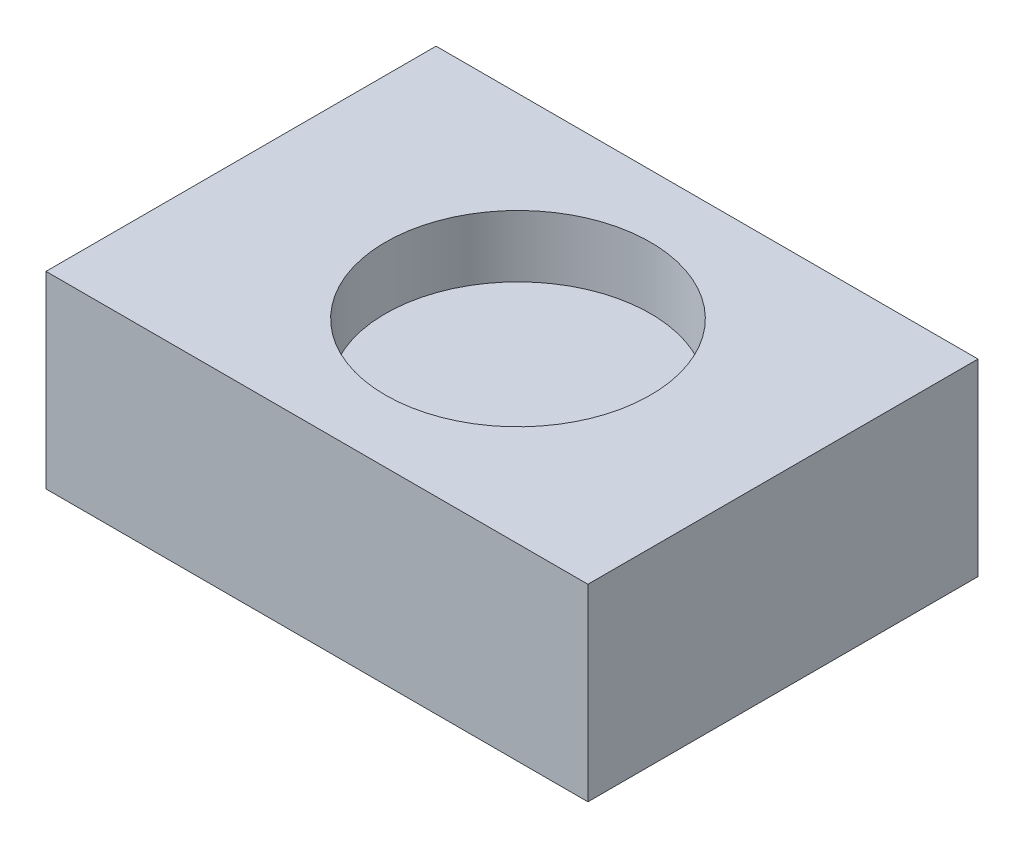
from build123d import *

# Parameters (mm, degrees)
CUT_EXTRUDE7_DEPTH               = 1010.950493836
CUT_EXTRUDE7_DEPTH_BACK          = 1010.950493836
SKETCH13_W                       = 48.176434887
SKETCH13_H                       = 155.804640487
SKETCH4_W                        = 600
SKETCH4_H                        = 44.158972604
CUT_EXTRUDE2_DEPTH               = 1010.950493836
SKETCH7_W                        = 159.807953253
SKETCH7_H                        = 69.49104999
BOSS_EXTRUDE7_DEPTH              = 5
FILLET5_R                        = 10
F_5_8_0_625_DIAMETER_HOLE1_D     = 15.875
F_5_8_0_625_DIAMETER_HOLE1_DEPTH = 30
F_5_8_0_625_DIAMETER_HOLE1_TIP   = 4.769331164
BOSS_EXTRUDE8_DEPTH              = 10
BOSS_EXTRUDE8_DEPTH_BACK         = 10
SKETCH16_W                       = 57.403477863
SKETCH16_H                       = 23.203595883
SKETCH17_W                       = 38.256761469
SKETCH17_H                       = 12.64819079
BOSS_EXTRUDE9_DEPTH              = 10
SKETCH18_W                       = 120
SKETCH18_H                       = 104.74536306
CUT_EXTRUDE8_DEPTH               = 161
FILLET6_R                        = 10
SKETCH19_R                       = 15
CUT_EXTRUDE9_DEPTH               = 7
CUT_EXTRUDE11_DEPTH              = 1010.950493856
CUT_EXTRUDE11_DEPTH_BACK         = 1010.950493856
SKETCH22_W                       = 1481.455902665
SKETCH22_H                       = 524.99926461
SKETCH22_W_2                     = 774.615564444
SKETCH22_H_2                     = 130
SKETCH23_W                       = 1033.221047575
SKETCH23_H                       = 313.410359552
SKETCH23_W_2                     = 790.959514037
SKETCH23_H_2                     = 163.499719248
CUT_EXTRUDE12_DEPTH              = 915.822387207
CUT_EXTRUDE13_DEPTH              = 908.868382599
CUT_EXTRUDE13_DEPTH_BACK         = 908.868382599
SKETCH24_W                       = 774.615564444
SKETCH24_H                       = 42.920513698
CUT_EXTRUDE14_DEPTH              = 908.868382607
CUT_EXTRUDE14_DEPTH_BACK         = 908.868382607
SKETCH25_W                       = 913.785959768
SKETCH25_H                       = 329.26502352
SKETCH25_W_2                     = 61.349903791
SKETCH25_H_2                     = 44.158972604


# Read off the part's stored shape, not the designer's step: Revolve1
with BuildPart() as part:
    # Revolve1 outline → Revolve1 (revolve)
    with BuildSketch(Plane.YX):
        with BuildLine():
            Line((0, 1000), (0, 0))
            ThreePointArc((0, 0), (70.710678154, 29.289321917), (100, 100.0000001))
            Line((100, 100.0000001), (100, 899.9999999))
            ThreePointArc((100, 899.9999999), (70.710678154, 970.710678083), (0, 1000))
        make_face()
    revolve(axis=Axis((0, 0, 0), (1, 0, 0)))

    # Sketch13 → Cut-Extrude7 (cut, two sides: drawn at the far end of the back side and taken through both)
    with BuildSketch(Plane(origin=(0, 0, 0), x_dir=(1, 0, 0), z_dir=(0, 1, 0)).offset(-CUT_EXTRUDE7_DEPTH_BACK)):
        with Locations((5.911782557, -3.075091589)):
            Rectangle(SKETCH13_W, SKETCH13_H)
    extrude(amount=CUT_EXTRUDE7_DEPTH + CUT_EXTRUDE7_DEPTH_BACK, mode=Mode.SUBTRACT)

    # Sketch4 → Cut-Extrude2 (cut, through all)
    with BuildSketch(Plane(origin=(0, 0, 0), x_dir=(1, 0, 0), z_dir=(0, 1, 0))):
        with Locations((595, 0)):
            Rectangle(SKETCH4_W, SKETCH4_H)
    extrude(amount=CUT_EXTRUDE2_DEPTH, mode=Mode.SUBTRACT)

    # Sketch7 → Boss-Extrude7 (add)
    with BuildSketch(Plane(origin=(0, 0, 0), x_dir=(1, 0, 0), z_dir=(0, 1, 0))):
        with Locations((745.885521462, -1.405844332)):
            Rectangle(SKETCH7_W, SKETCH7_H)
    extrude(amount=-BOSS_EXTRUDE7_DEPTH)

    # Fillet5
    fillet5_edges = [part.edges().sort_by_distance(p)[0] for p in [
        (30, -71.414284286, 0),
    ]]
    fillet(fillet5_edges, radius=FILLET5_R)

    # 5/8 (0.625) Diameter Hole1
    with Locations(Plane.ZY.offset(-30)):
        with Locations((0, 0)):
            Hole(F_5_8_0_625_DIAMETER_HOLE1_D / 2, depth=F_5_8_0_625_DIAMETER_HOLE1_DEPTH)
            with Locations((0, 0, -(F_5_8_0_625_DIAMETER_HOLE1_DEPTH + F_5_8_0_625_DIAMETER_HOLE1_TIP / 2))):  # 118° drill point
                Cone(0, F_5_8_0_625_DIAMETER_HOLE1_D / 2, F_5_8_0_625_DIAMETER_HOLE1_TIP, mode=Mode.SUBTRACT)

    # Sketch16 → Boss-Extrude8 (add, two sides: drawn at the far end of the back side and taken through both)
    with BuildSketch(Plane.XY.offset(-BOSS_EXTRUDE8_DEPTH_BACK)):
        with Locations((738.294537666, -11.601797942)):
            Rectangle(SKETCH16_W, SKETCH16_H)
    extrude(amount=BOSS_EXTRUDE8_DEPTH + BOSS_EXTRUDE8_DEPTH_BACK)

    # Sketch17 → Boss-Extrude9 (add)
    with BuildSketch(Plane.XY.offset(-22.079486302)):
        with Locations((787.071835847, 6.324095395)):
            Rectangle(SKETCH17_W, SKETCH17_H)
    extrude(amount=-BOSS_EXTRUDE9_DEPTH)

    # Sketch18 → Cut-Extrude8 (cut)
    with BuildSketch(Plane(origin=(0, 0, 0), x_dir=(1, 0, 0), z_dir=(0, 1, 0))):
        with Locations((204.992275313, 0)):
            Rectangle(SKETCH18_W, SKETCH18_H)
    extrude(amount=CUT_EXTRUDE8_DEPTH, mode=Mode.SUBTRACT)

    # Fillet6
    fillet6_edges = [part.edges().sort_by_distance(p)[0] for p in [
        (144.992275313, 42.594313674, -52.37268153),
        (144.992275313, 42.594313674, 52.37268153),
        (264.992275313, 42.594313674, 52.37268153),
        (264.992275313, 42.594313674, -52.37268153),
    ]]
    fillet(fillet6_edges, radius=FILLET6_R)

    # Sketch19 → Cut-Extrude9 (cut)
    with BuildSketch(Plane(origin=(0, 0, 0), x_dir=(1, 0, 0), z_dir=(0, 1, 0))):
        with Locations(Location((865, 0, 0), (0, 0, 270))):
            Circle(SKETCH19_R)
    extrude(amount=-CUT_EXTRUDE9_DEPTH, mode=Mode.SUBTRACT)

    # Sketch22 → Cut-Extrude11 (cut, two sides: drawn at the far end of the back side and taken through both)
    with BuildSketch(Plane(origin=(0, 0, 0), x_dir=(1, 0, 0), z_dir=(0, 1, 0)).offset(-CUT_EXTRUDE11_DEPTH_BACK)):
        with Locations((406.155110175, 0)):
            Rectangle(SKETCH22_W, SKETCH22_H)
        with Locations((512.692217778, 0)):
            Rectangle(SKETCH22_W_2, SKETCH22_H_2, mode=Mode.SUBTRACT)
    extrude(amount=CUT_EXTRUDE11_DEPTH + CUT_EXTRUDE11_DEPTH_BACK, mode=Mode.SUBTRACT)

    # Sketch23 → Cut-Extrude12 (cut, through all)
    with BuildSketch(Plane.XY.offset(65)):
        with Locations((481.89787613, -1.932796335)):
            Rectangle(SKETCH23_W, SKETCH23_H)
        with Locations((520.864192575, 60.415600646)):
            Rectangle(SKETCH23_W_2, SKETCH23_H_2, mode=Mode.SUBTRACT)
    extrude(amount=-CUT_EXTRUDE12_DEPTH, mode=Mode.SUBTRACT)

    # Sketch24 → Cut-Extrude13 (cut, two sides: drawn at the far end of the back side and taken through both)
    with BuildSketch(Plane(origin=(0, 0, 0), x_dir=(1, 0, 0), z_dir=(0, 1, 0)).offset(-CUT_EXTRUDE13_DEPTH_BACK)):
        with Locations((512.692217778, -43.539743151)):
            Rectangle(SKETCH24_W, SKETCH24_H)
    extrude(amount=CUT_EXTRUDE13_DEPTH + CUT_EXTRUDE13_DEPTH_BACK, mode=Mode.SUBTRACT)

    # Sketch25 → Cut-Extrude14 (cut, two sides: drawn at the far end of the back side and taken through both)
    with BuildSketch(Plane(origin=(0, 0, 0), x_dir=(1, 0, 0), z_dir=(0, 1, 0)).offset(-CUT_EXTRUDE14_DEPTH_BACK)):
        with Locations((557.248723254, -2.517184657)):
            Rectangle(SKETCH25_W, SKETCH25_H)
        with Locations((864.325048104, 0)):
            Rectangle(SKETCH25_W_2, SKETCH25_H_2, mode=Mode.SUBTRACT)
    extrude(amount=CUT_EXTRUDE14_DEPTH + CUT_EXTRUDE14_DEPTH_BACK, mode=Mode.SUBTRACT)


solid = part.part
